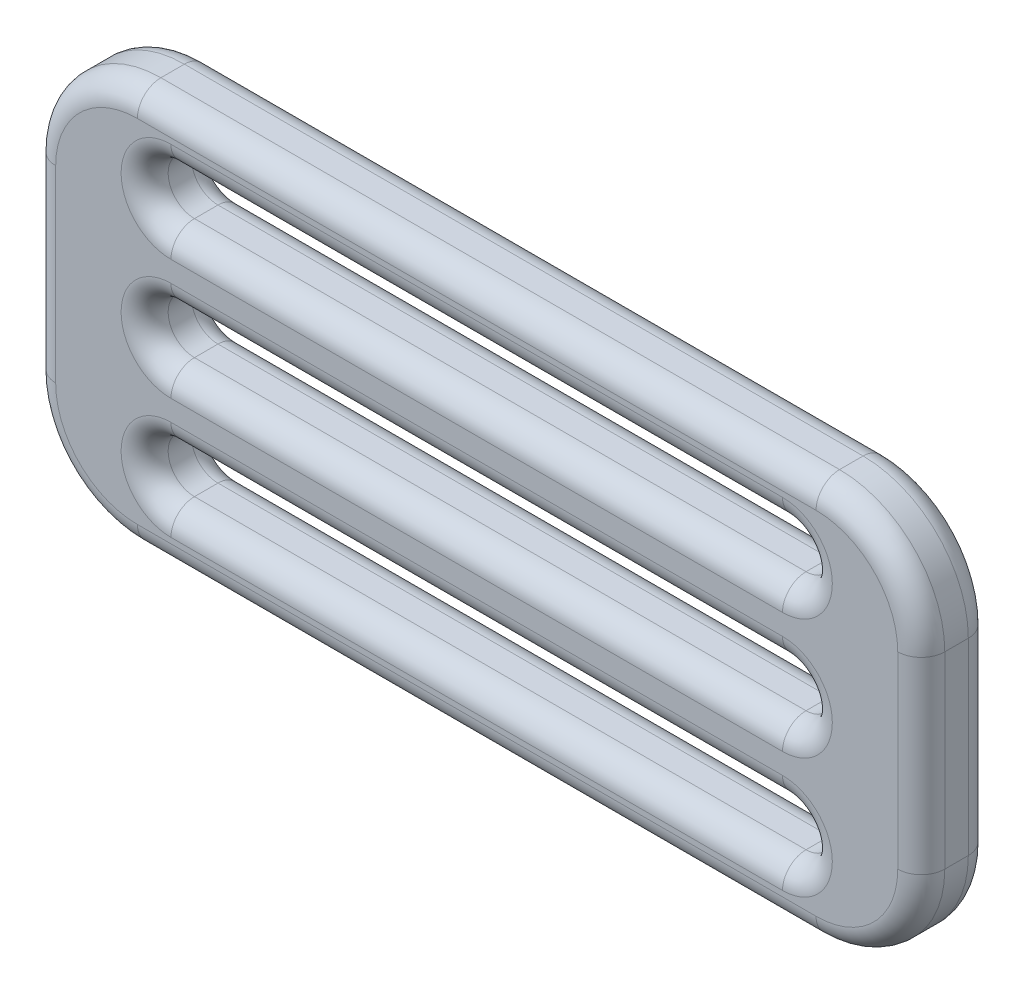
from build123d import *

# Parameters (mm, degrees)
BOSS_EXTRUDE1_DEPTH = 3
FILLET1_R           = 1


with BuildPart() as part:
    # Sketch1 → Boss-Extrude1 (new body)
    with BuildSketch(Plane(origin=(0, 0, 0.6), x_dir=(-1, 0, 0), z_dir=(0, 0, -1))):
        with BuildLine():
            Line((-4.473372781, 35.786982249), (-33.326627219, 35.786982249))
            ThreePointArc((-33.326627219, 35.786982249), (-36.489779447, 34.476761696), (-37.8, 31.313609467))
            Line((-37.8, 31.313609467), (-37.8, 23.313609467))
            ThreePointArc((-37.8, 23.313609467), (-36.489779447, 20.150457239), (-33.326627219, 18.840236686))
            Line((-33.326627219, 18.840236686), (-4.473372781, 18.840236686))
            ThreePointArc((-4.473372781, 18.840236686), (-1.310220553, 20.150457239), (0, 23.313609467))
            Line((0, 23.313609467), (0, 31.313609467))
            ThreePointArc((0, 31.313609467), (-1.310220553, 34.476761696), (-4.473372781, 35.786982249))
        make_face()
        with BuildLine():
            Line((-5.9, 23.313609467), (-31.9, 23.313609467))
            ThreePointArc((-31.9, 23.313609467), (-33.018343195, 22.195266272), (-31.9, 21.076923077))
            Line((-31.9, 21.076923077), (-5.9, 21.076923077))
            ThreePointArc((-5.9, 21.076923077), (-4.781656805, 22.195266272), (-5.9, 23.313609467))
        make_face(mode=Mode.SUBTRACT)
        with BuildLine():
            Line((-5.9, 26.195389554), (-31.9, 26.195389554))
            ThreePointArc((-31.9, 26.195389554), (-33.018343195, 27.313732749), (-31.9, 28.432075944))
            Line((-31.9, 28.432075944), (-5.9, 28.432075944))
            ThreePointArc((-5.9, 28.432075944), (-4.781656805, 27.313732749), (-5.9, 26.195389554))
        make_face(mode=Mode.SUBTRACT)
        with BuildLine():
            Line((-5.9, 31.31385603), (-31.9, 31.31385603))
            ThreePointArc((-31.9, 31.31385603), (-33.018343195, 32.432199225), (-31.9, 33.550542421))
            Line((-31.9, 33.550542421), (-5.9, 33.550542421))
            ThreePointArc((-5.9, 33.550542421), (-4.781656805, 32.432199225), (-5.9, 31.31385603))
        make_face(mode=Mode.SUBTRACT)
    extrude(amount=-BOSS_EXTRUDE1_DEPTH)

    # Fillet1
    fillet1_edges = [part.edges().sort_by_distance(p)[0] for p in [
        (18.9, 35.786982249, 3.6),
        (36.489779447, 34.476761696, 3.6),
        (37.8, 27.313609467, 3.6),
        (36.489779447, 20.150457239, 3.6),
        (18.9, 18.840236686, 3.6),
        (1.310220553, 20.150457239, 3.6),
        (0, 27.313609467, 3.6),
        (1.310220553, 34.476761696, 3.6),
        (33.018343195, 22.195266272, 3.6),
        (18.9, 23.313609467, 3.6),
        (4.781656805, 22.195266272, 3.6),
        (18.9, 21.076923077, 3.6),
        (33.018343195, 32.432199225, 3.6),
        (18.9, 33.550542421, 3.6),
        (4.781656805, 32.432199225, 3.6),
        (18.9, 31.31385603, 3.6),
        (0, 27.313609467, 0.6),
        (1.310220553, 20.150457239, 0.6),
        (18.9, 18.840236686, 0.6),
        (36.489779447, 20.150457239, 0.6),
        (37.8, 27.313609467, 0.6),
        (36.489779447, 34.476761696, 0.6),
        (18.9, 35.786982249, 0.6),
        (1.310220553, 34.476761696, 0.6),
        (18.9, 23.313609467, 0.6),
        (33.018343195, 22.195266272, 0.6),
        (18.9, 21.076923077, 0.6),
        (4.781656805, 22.195266272, 0.6),
        (18.9, 33.550542421, 0.6),
        (33.018343195, 32.432199225, 0.6),
        (18.9, 31.31385603, 0.6),
        (4.781656805, 32.432199225, 0.6),
        (33.018343195, 27.313732749, 3.6),
        (18.9, 28.432075944, 3.6),
        (4.781656805, 27.313732749, 3.6),
        (18.9, 26.195389554, 3.6),
        (18.9, 28.432075944, 0.6),
        (33.018343195, 27.313732749, 0.6),
        (18.9, 26.195389554, 0.6),
        (4.781656805, 27.313732749, 0.6),
    ]]
    fillet(fillet1_edges, radius=FILLET1_R)


solid = part.part
